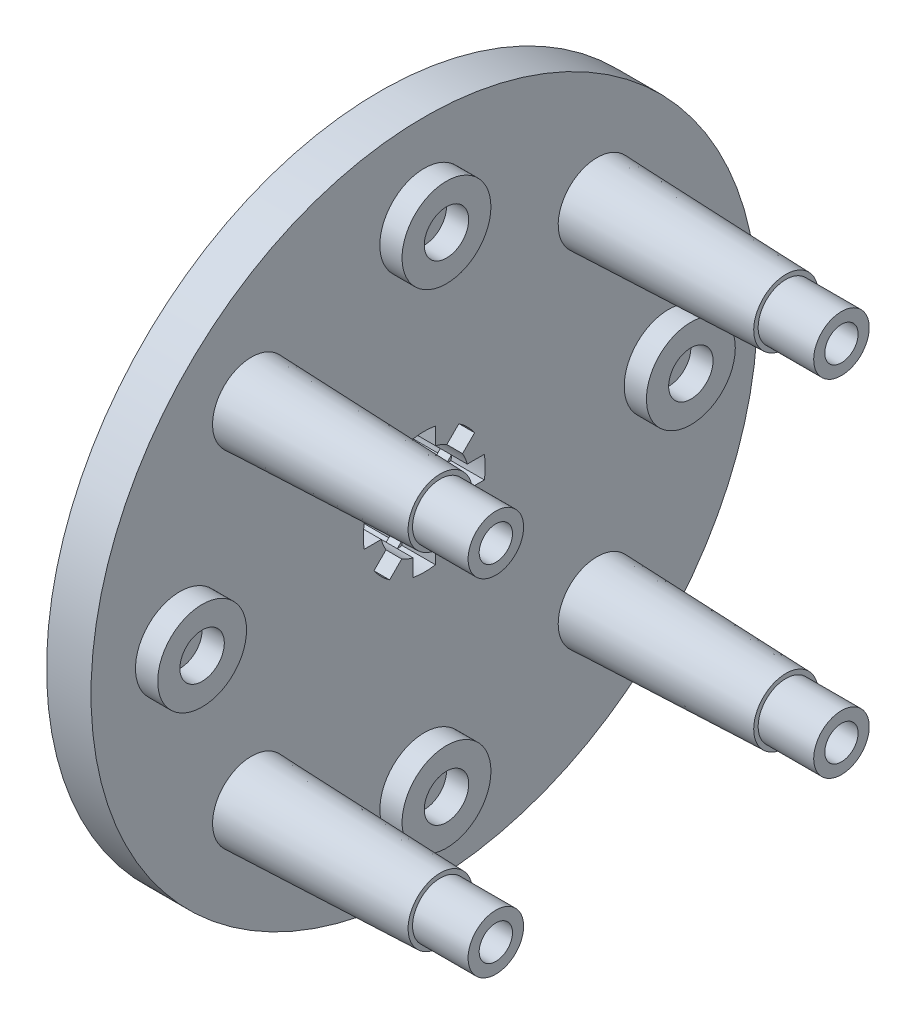
from build123d import *

# Parameters (mm, degrees)
SKETCH_1_R               = 30
EXTRUDE_1_DEPTH          = 4
SKETCH_7_R               = 28
CUT_EXTRUDE_4_DEPTH      = 1
EXTRUDE_3_DEPTH          = 1
SKETCH_9_R               = 4
EXTRUDE_5_DEPTH          = 1
EXTRUDE_5_2_DEPTH        = 1
EXTRUDE_5_3_DEPTH        = 1
EXTRUDE_5_4_DEPTH        = 1
SKETCH_11_R              = 2
CUT_EXTRUDE_8_DEPTH      = 2
PATTERN_CIRCULAR_1_COUNT = 4
CUT_EXTRUDE_START        = -14
CUT_EXTRUDE_9_DEPTH      = 14
CUT_EXTRUDE_START_2      = -18
CUT_EXTRUDE_9_2_DEPTH    = 3
CUT_EXTRUDE_START_3      = -15
CUT_EXTRUDE_9_3_DEPTH    = 1
SKETCH_17_R              = 4
SKETCH_17_R_2            = 2
EXTRUDE_7_DEPTH          = 2
PATTERN_CIRCULAR_6_COUNT = 4


# Read off the part's stored shape, not the designer's step: 切除-拉伸9
with BuildPart() as part:
    # 草图1 → 凸台-拉伸1 (new body)
    with BuildSketch(Plane(origin=(0, 0, 0), x_dir=(0, 0, -1), z_dir=(1, 0, 0))):
        Circle(SKETCH_1_R)
    extrude(amount=EXTRUDE_1_DEPTH)

    # 草图3 → 旋转1 (revolve)
    with BuildSketch(Plane(origin=(0, 0, 0), x_dir=(1, 0, 0), z_dir=(0, 1, 0)), mode=Mode.PRIVATE) as revolve_1_sk:
        Polygon((0, 10), (-14, 9), (-14, 0), (0, 0), align=None)
    revolve(revolve_1_sk.sketch.rotate(Axis((-20.808457728, 0, 0), (1, 0, 0)), 180), axis=Axis((-20.808457728, 0, 0), (1, 0, 0)))

    # 草图7 → 切除-拉伸4 (cut)
    with BuildSketch(Plane.ZY):
        Circle(SKETCH_7_R)
    extrude(amount=-CUT_EXTRUDE_4_DEPTH, mode=Mode.SUBTRACT)


with BuildPart() as cut_extrude_4_piece_1:
    # of the separate pieces the step leaves, piece 1, a body of its own (cut_extrude_4_pieces)
    add(part.part.solids().sort_by_distance((0, 0, -30))[0])


with BuildPart() as cut_extrude_4_piece_2:
    # of the separate pieces the step leaves, piece 2, a body of its own (cut_extrude_4_pieces)
    add(part.part.solids().sort_by_distance((0, 0, 10))[0])

    # 切除-拉伸9 outline → 切除-拉伸9 (cut)
    with BuildSketch(Plane.ZY.offset(14).offset(CUT_EXTRUDE_START)):
        with BuildLine():
            Line((5.408326913, 1), (3.872983346, 1))
            ThreePointArc((3.872983346, 1), (3.69551813, 1.530733729), (3.445719569, 2.031506006))
            Line((3.445719569, 2.031506006), (3.712310601, 2.298097039))
            Line((3.712310601, 2.298097039), (4.531371416, 3.117157854))
            ThreePointArc((4.531371416, 3.117157854), (3.889087297, 3.889087297), (3.117157854, 4.531371416))
            Line((3.117157854, 4.531371416), (2.298097039, 3.712310601))
            Line((2.298097039, 3.712310601), (2.031506006, 3.445719569))
            ThreePointArc((2.031506006, 3.445719569), (1.530733729, 3.69551813), (1, 3.872983346))
            Line((1, 3.872983346), (1, 5.408326913))
            ThreePointArc((1, 5.408326913), (0.769021968, 5.445971466), (0.536651613, 5.473756027))
            ThreePointArc((0.536651613, 5.473756027), (0, 5.5), (-0.536651613, 5.473756027))
            ThreePointArc((-0.536651613, 5.473756027), (-0.769021968, 5.445971466), (-1, 5.408326913))
            Line((-1, 5.408326913), (-1, 3.872983346))
            ThreePointArc((-1, 3.872983346), (-1.530733729, 3.69551813), (-2.031506006, 3.445719569))
            Line((-2.031506006, 3.445719569), (-2.298097039, 3.712310601))
            Line((-2.298097039, 3.712310601), (-3.117157854, 4.531371416))
            ThreePointArc((-3.117157854, 4.531371416), (-3.889087297, 3.889087297), (-4.531371416, 3.117157854))
            Line((-4.531371416, 3.117157854), (-3.712310601, 2.298097039))
            Line((-3.712310601, 2.298097039), (-3.445719569, 2.031506006))
            ThreePointArc((-3.445719569, 2.031506006), (-3.69551813, 1.530733729), (-3.872983346, 1))
            Line((-3.872983346, 1), (-5.408326913, 1))
            ThreePointArc((-5.408326913, 1), (-5.445971466, 0.769021968), (-5.473756027, 0.536651613))
            ThreePointArc((-5.473756027, 0.536651613), (-5.495021094, -0.233972593), (-5.408326913, -1))
            Line((-5.408326913, -1), (-3.872983346, -1))
            ThreePointArc((-3.872983346, -1), (-3.69551813, -1.530733729), (-3.445719569, -2.031506006))
            Line((-3.445719569, -2.031506006), (-4.531371416, -3.117157854))
            ThreePointArc((-4.531371416, -3.117157854), (-3.889087297, -3.889087297), (-3.117157854, -4.531371416))
            Line((-3.117157854, -4.531371416), (-2.031506006, -3.445719569))
            ThreePointArc((-2.031506006, -3.445719569), (-1.530733729, -3.69551813), (-1, -3.872983346))
            Line((-1, -3.872983346), (-1, -5.408326913))
            ThreePointArc((-1, -5.408326913), (0, -5.5), (1, -5.408326913))
            Line((1, -5.408326913), (1, -3.872983346))
            ThreePointArc((1, -3.872983346), (1.530733729, -3.69551813), (2.031506006, -3.445719569))
            Line((2.031506006, -3.445719569), (3.117157854, -4.531371416))
            ThreePointArc((3.117157854, -4.531371416), (3.889087297, -3.889087297), (4.531371416, -3.117157854))
            Line((4.531371416, -3.117157854), (3.445719569, -2.031506006))
            ThreePointArc((3.445719569, -2.031506006), (3.69551813, -1.530733729), (3.872983346, -1))
            Line((3.872983346, -1), (5.408326913, -1))
            ThreePointArc((5.408326913, -1), (5.495021094, -0.233972593), (5.473756027, 0.536651613))
            ThreePointArc((5.473756027, 0.536651613), (5.445971466, 0.769021968), (5.408326913, 1))
        make_face()
    extrude(amount=CUT_EXTRUDE_9_DEPTH, mode=Mode.SUBTRACT)


with BuildPart() as body_3:
    # 草图8 → 凸台-拉伸3 (new body)
    with BuildSketch(Plane.ZY.offset(-1)):
        with BuildLine():
            Line((-19.798989873, 19.798989873), (-3.00520382, 3.00520382))
            Line((-3.00520382, 3.00520382), (0, 6.01040764))
            Line((0, 6.01040764), (-16.564383554, 22.574791194))
            ThreePointArc((-16.564383554, 22.574791194), (-18.234582529, 21.248529361), (-19.798989873, 19.798989873))
        make_face()
        with BuildLine():
            Line((-6.01040764, 0), (-3.00520382, 3.00520382))
            Line((-3.00520382, 3.00520382), (-19.798989873, 19.798989873))
            ThreePointArc((-19.798989873, 19.798989873), (-21.248529361, 18.234582529), (-22.574791194, 16.564383554))
            Line((-22.574791194, 16.564383554), (-6.01040764, 0))
        make_face()
        with BuildLine():
            Line((-19.798989873, -19.798989873), (-3.00520382, -3.00520382))
            Line((-3.00520382, -3.00520382), (-6.01040764, 0))
            Line((-6.01040764, 0), (-22.574791194, -16.564383554))
            ThreePointArc((-22.574791194, -16.564383554), (-21.248529361, -18.234582529), (-19.798989873, -19.798989873))
        make_face()
        with BuildLine():
            Line((0, -6.01040764), (-3.00520382, -3.00520382))
            Line((-3.00520382, -3.00520382), (-19.798989873, -19.798989873))
            ThreePointArc((-19.798989873, -19.798989873), (-18.234582529, -21.248529361), (-16.564383554, -22.574791194))
            Line((-16.564383554, -22.574791194), (0, -6.01040764))
        make_face()
        with BuildLine():
            Line((19.798989873, -19.798989873), (3.00520382, -3.00520382))
            Line((3.00520382, -3.00520382), (0, -6.01040764))
            Line((0, -6.01040764), (16.564383554, -22.574791194))
            ThreePointArc((16.564383554, -22.574791194), (18.234582529, -21.248529361), (19.798989873, -19.798989873))
        make_face()
        with BuildLine():
            Line((6.01040764, 0), (3.00520382, -3.00520382))
            Line((3.00520382, -3.00520382), (19.798989873, -19.798989873))
            ThreePointArc((19.798989873, -19.798989873), (21.248529361, -18.234582529), (22.574791194, -16.564383554))
            Line((22.574791194, -16.564383554), (6.01040764, 0))
        make_face()
        with BuildLine():
            Line((19.798989873, 19.798989873), (3.00520382, 3.00520382))
            Line((3.00520382, 3.00520382), (6.01040764, 0))
            Line((6.01040764, 0), (22.574791194, 16.564383554))
            ThreePointArc((22.574791194, 16.564383554), (21.248529361, 18.234582529), (19.798989873, 19.798989873))
        make_face()
        with BuildLine():
            Line((0, 6.01040764), (3.00520382, 3.00520382))
            Line((3.00520382, 3.00520382), (19.798989873, 19.798989873))
            ThreePointArc((19.798989873, 19.798989873), (18.234582529, 21.248529361), (16.564383554, 22.574791194))
            Line((16.564383554, 22.574791194), (0, 6.01040764))
        make_face()
    extrude(amount=EXTRUDE_3_DEPTH)


with BuildPart() as body_4:
    # 草图9 → 凸台-拉伸5 (new body)
    with BuildSketch(Plane.ZY.offset(-1)):
        with Locations((0, 22)):
            Circle(SKETCH_9_R)
    extrude(amount=EXTRUDE_5_DEPTH)


with BuildPart() as body_5:
    # 草图9 → Extrude 5 2 (new body)
    with BuildSketch(Plane.ZY.offset(-1)):
        with Locations((22, 0)):
            Circle(SKETCH_9_R)
    extrude(amount=EXTRUDE_5_2_DEPTH)


with BuildPart() as body_6:
    # 草图9 → Extrude 5 3 (new body)
    with BuildSketch(Plane.ZY.offset(-1)):
        with Locations((0, -22)):
            Circle(SKETCH_9_R)
    extrude(amount=EXTRUDE_5_3_DEPTH)


with BuildPart() as body_7:
    # 草图9 → Extrude 5 4 (new body)
    with BuildSketch(Plane.ZY.offset(-1)):
        with Locations((-22, 0)):
            Circle(SKETCH_9_R)
    extrude(amount=EXTRUDE_5_4_DEPTH)


with BuildPart() as cut_extrude_8_tool:
    # 草图11 → 切除-拉伸8 (new body)
    with BuildSketch(Plane.ZY):
        with Locations((-15.556349186, 15.556349186)):
            Circle(SKETCH_11_R)
    cut_extrude_8 = extrude(amount=-CUT_EXTRUDE_8_DEPTH)


with BuildPart() as cut_extrude_4_piece_1_1:
    add(cut_extrude_4_piece_1.part)

    # 切除-拉伸8: cut by cut_extrude_8_tool
    add(cut_extrude_8_tool.part, mode=Mode.SUBTRACT)


with BuildPart() as body_3_1:
    add(body_3.part)

    # 切除-拉伸8: cut by cut_extrude_8_tool
    add(cut_extrude_8_tool.part, mode=Mode.SUBTRACT)


with BuildPart() as pattern_circular_1_tool:
    # 阵列(圆周)1: 切除-拉伸8 ×4 about axis
    pattern_circular_1_axis = Axis((0, 0, 0), (1, 0, 0))
    for i in range(1, PATTERN_CIRCULAR_1_COUNT):
        add(cut_extrude_8.rotate(pattern_circular_1_axis, i * 360 / PATTERN_CIRCULAR_1_COUNT))


with BuildPart() as cut_extrude_4_piece_1_2:
    add(cut_extrude_4_piece_1_1.part)

    # 阵列(圆周)1: cut by pattern_circular_1_tool
    add(pattern_circular_1_tool.part, mode=Mode.SUBTRACT)

    # Cut-Extrude 9 2 outline → Cut-Extrude 9 2 (cut)
    with BuildSketch(Plane.ZY.offset(14).offset(CUT_EXTRUDE_START_2)):
        with BuildLine():
            Line((5.408326913, 1), (3.872983346, 1))
            ThreePointArc((3.872983346, 1), (3.69551813, 1.530733729), (3.445719569, 2.031506006))
            Line((3.445719569, 2.031506006), (3.712310601, 2.298097039))
            Line((3.712310601, 2.298097039), (4.531371416, 3.117157854))
            ThreePointArc((4.531371416, 3.117157854), (3.889087297, 3.889087297), (3.117157854, 4.531371416))
            Line((3.117157854, 4.531371416), (2.298097039, 3.712310601))
            Line((2.298097039, 3.712310601), (2.031506006, 3.445719569))
            ThreePointArc((2.031506006, 3.445719569), (1.530733729, 3.69551813), (1, 3.872983346))
            Line((1, 3.872983346), (1, 5.408326913))
            ThreePointArc((1, 5.408326913), (0.769021968, 5.445971466), (0.536651613, 5.473756027))
            ThreePointArc((0.536651613, 5.473756027), (0, 5.5), (-0.536651613, 5.473756027))
            ThreePointArc((-0.536651613, 5.473756027), (-0.769021968, 5.445971466), (-1, 5.408326913))
            Line((-1, 5.408326913), (-1, 3.872983346))
            ThreePointArc((-1, 3.872983346), (-1.530733729, 3.69551813), (-2.031506006, 3.445719569))
            Line((-2.031506006, 3.445719569), (-2.298097039, 3.712310601))
            Line((-2.298097039, 3.712310601), (-3.117157854, 4.531371416))
            ThreePointArc((-3.117157854, 4.531371416), (-3.889087297, 3.889087297), (-4.531371416, 3.117157854))
            Line((-4.531371416, 3.117157854), (-3.712310601, 2.298097039))
            Line((-3.712310601, 2.298097039), (-3.445719569, 2.031506006))
            ThreePointArc((-3.445719569, 2.031506006), (-3.69551813, 1.530733729), (-3.872983346, 1))
            Line((-3.872983346, 1), (-5.408326913, 1))
            ThreePointArc((-5.408326913, 1), (-5.445971466, 0.769021968), (-5.473756027, 0.536651613))
            ThreePointArc((-5.473756027, 0.536651613), (-5.495021094, -0.233972593), (-5.408326913, -1))
            Line((-5.408326913, -1), (-3.872983346, -1))
            ThreePointArc((-3.872983346, -1), (-3.69551813, -1.530733729), (-3.445719569, -2.031506006))
            Line((-3.445719569, -2.031506006), (-4.531371416, -3.117157854))
            ThreePointArc((-4.531371416, -3.117157854), (-3.889087297, -3.889087297), (-3.117157854, -4.531371416))
            Line((-3.117157854, -4.531371416), (-2.031506006, -3.445719569))
            ThreePointArc((-2.031506006, -3.445719569), (-1.530733729, -3.69551813), (-1, -3.872983346))
            Line((-1, -3.872983346), (-1, -5.408326913))
            ThreePointArc((-1, -5.408326913), (0, -5.5), (1, -5.408326913))
            Line((1, -5.408326913), (1, -3.872983346))
            ThreePointArc((1, -3.872983346), (1.530733729, -3.69551813), (2.031506006, -3.445719569))
            Line((2.031506006, -3.445719569), (3.117157854, -4.531371416))
            ThreePointArc((3.117157854, -4.531371416), (3.889087297, -3.889087297), (4.531371416, -3.117157854))
            Line((4.531371416, -3.117157854), (3.445719569, -2.031506006))
            ThreePointArc((3.445719569, -2.031506006), (3.69551813, -1.530733729), (3.872983346, -1))
            Line((3.872983346, -1), (5.408326913, -1))
            ThreePointArc((5.408326913, -1), (5.495021094, -0.233972593), (5.473756027, 0.536651613))
            ThreePointArc((5.473756027, 0.536651613), (5.445971466, 0.769021968), (5.408326913, 1))
        make_face()
    extrude(amount=CUT_EXTRUDE_9_2_DEPTH, mode=Mode.SUBTRACT)

    # 草图17 → 凸台-拉伸7 (add)
    # profile 1 of 4: a face of its own
    with BuildSketch(Plane(origin=(4, 0, 0), x_dir=(0, 0, -1), z_dir=(1, 0, 0))):
        with Locations(Location((0, 22, 0), (0, 0, 180))):
            Circle(SKETCH_17_R)
        with Locations((0, 22)):
            Circle(SKETCH_17_R_2, mode=Mode.SUBTRACT)
    # profile 2 of 4: a face of its own
    with BuildSketch(Plane(origin=(4, 0, 0), x_dir=(0, 0, -1), z_dir=(1, 0, 0))):
        with Locations((22.001, 0.001)):
            Circle(SKETCH_17_R)
        with Locations((22.001, 0.001)):
            Circle(SKETCH_17_R_2, mode=Mode.SUBTRACT)
    # profile 3 of 4: a face of its own
    with BuildSketch(Plane(origin=(4, 0, 0), x_dir=(0, 0, -1), z_dir=(1, 0, 0))):
        with Locations((0.002, -22)):
            Circle(SKETCH_17_R)
        with Locations((0.002, -22)):
            Circle(SKETCH_17_R_2, mode=Mode.SUBTRACT)
    # profile 4 of 4: a face of its own
    with BuildSketch(Plane(origin=(4, 0, 0), x_dir=(0, 0, -1), z_dir=(1, 0, 0))):
        with Locations((-21.999, -0.001)):
            Circle(SKETCH_17_R)
        with Locations((-21.999, -0.001)):
            Circle(SKETCH_17_R_2, mode=Mode.SUBTRACT)
    extrude(amount=EXTRUDE_7_DEPTH)

    # 草图21 → 旋转2 (revolve)
    with BuildSketch(Plane(origin=(0, 0, 0), x_dir=(0, 0.7071067811865439, 0.7071067811865512), z_dir=(0, -0.7071067811865512, 0.7071067811865439)), mode=Mode.PRIVATE) as revolve_2_sk:
        Polygon((-22, -4), (-25.5, -4), (-24.9, -21), (-24.5, -21), (-24.5, -26), (-23.5, -26), (-23.5, -23), (-22, -23), align=None)
    revolve_2 = revolve(revolve_2_sk.sketch.rotate(Axis((4, -15.556349186, -15.556349186), (1, 0, 0)), 225), axis=Axis((4, -15.556349186, -15.556349186), (1, 0, 0)))

    # 阵列(圆周)6: 旋转2 ×4 about axis
    pattern_circular_6_axis = Axis((0, 0, 0), (1, 0, 0))
    for i in range(1, PATTERN_CIRCULAR_6_COUNT):
        add(revolve_2.rotate(pattern_circular_6_axis, i * 360 / PATTERN_CIRCULAR_6_COUNT))


with BuildPart() as body_3_2:
    add(body_3_1.part)

    # 阵列(圆周)1: cut by pattern_circular_1_tool
    add(pattern_circular_1_tool.part, mode=Mode.SUBTRACT)

    # Cut-Extrude 9 3 outline → Cut-Extrude 9 3 (cut)
    with BuildSketch(Plane.ZY.offset(14).offset(CUT_EXTRUDE_START_3)):
        with BuildLine():
            Line((5.01040764, 1), (5.473756027, 0.536651613))
            ThreePointArc((5.473756027, 0.536651613), (5.445971466, 0.769021968), (5.408326913, 1))
            Line((5.408326913, 1), (5.01040764, 1))
        make_face()
        with BuildLine():
            Line((2.298097039, 3.712310601), (3.712310601, 2.298097039))
            Line((3.712310601, 2.298097039), (4.531371416, 3.117157854))
            ThreePointArc((4.531371416, 3.117157854), (3.889087297, 3.889087297), (3.117157854, 4.531371416))
            Line((3.117157854, 4.531371416), (2.298097039, 3.712310601))
        make_face()
        with BuildLine():
            Line((0.536651613, 5.473756027), (1, 5.01040764))
            Line((1, 5.01040764), (1, 5.408326913))
            ThreePointArc((1, 5.408326913), (0.769021968, 5.445971466), (0.536651613, 5.473756027))
        make_face()
        with BuildLine():
            Line((-1, 5.01040764), (-0.536651613, 5.473756027))
            ThreePointArc((-0.536651613, 5.473756027), (-0.769021968, 5.445971466), (-1, 5.408326913))
            Line((-1, 5.408326913), (-1, 5.01040764))
        make_face()
        with BuildLine():
            Line((-3.712310601, 2.298097039), (-2.298097039, 3.712310601))
            Line((-2.298097039, 3.712310601), (-3.117157854, 4.531371416))
            ThreePointArc((-3.117157854, 4.531371416), (-3.889087297, 3.889087297), (-4.531371416, 3.117157854))
            Line((-4.531371416, 3.117157854), (-3.712310601, 2.298097039))
        make_face()
        with BuildLine():
            Line((-5.473756027, 0.536651613), (-5.01040764, 1))
            Line((-5.01040764, 1), (-5.408326913, 1))
            ThreePointArc((-5.408326913, 1), (-5.445971466, 0.769021968), (-5.473756027, 0.536651613))
        make_face()
    extrude(amount=CUT_EXTRUDE_9_3_DEPTH, mode=Mode.SUBTRACT)


solid = Compound([cut_extrude_4_piece_2.part, body_4.part, body_5.part, body_6.part, body_7.part, cut_extrude_4_piece_1_2.part, body_3_2.part])
